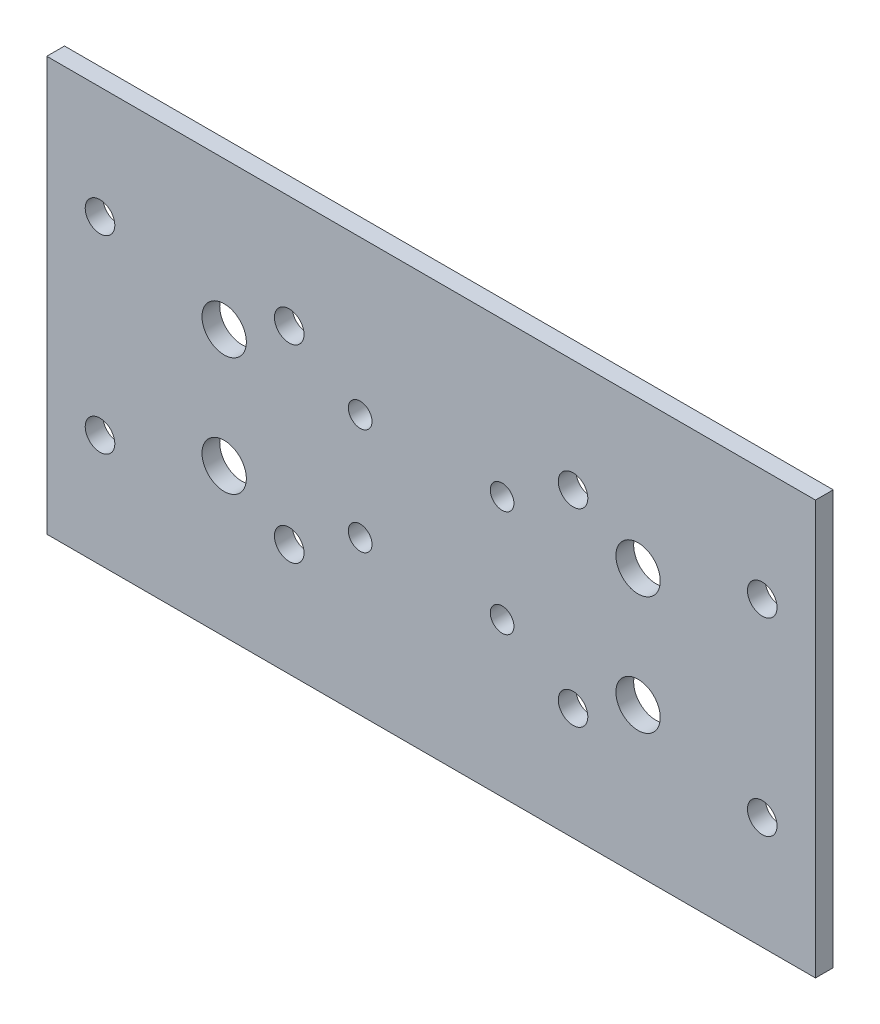
from build123d import *

# Parameters (mm, degrees)
SKETCH1_W          = 130
SKETCH1_H          = 70
BASE_FLANGE1_DEPTH = 3
SKETCH12_R         = 2.5
SKETCH12_R_2       = 2
CUT_EXTRUDE1_DEPTH = 10
SKETCH13_R         = 3.75
CUT_EXTRUDE2_DEPTH = 10


# Sheet-metal steps are written as plain solids
with BuildPart() as part:
    # Sketch1 → Base-Flange1 (new body)
    with BuildSketch(Plane.XY):
        Rectangle(SKETCH1_W, SKETCH1_H)
    extrude(amount=BASE_FLANGE1_DEPTH)

    # Sketch12 → Cut-Extrude1 (cut)
    with BuildSketch(Plane(origin=(0, 0, 0), x_dir=(-1, 0, 0), z_dir=(0, 0, -1))):
        with Locations((56, 16)):
            Circle(SKETCH12_R)
        with Locations((56, -16)):
            Circle(SKETCH12_R)
        with Locations((24, -16)):
            Circle(SKETCH12_R)
        with Locations((24, 16)):
            Circle(SKETCH12_R)
        with Locations(Location((-24, 16, 0), (0, 0, 180))):
            Circle(SKETCH12_R)
        with Locations(Location((-24, -16, 0), (0, 0, 180))):
            Circle(SKETCH12_R)
        with Locations(Location((-56, -16, 0), (0, 0, 180))):
            Circle(SKETCH12_R)
        with Locations(Location((-56, 16, 0), (0, 0, 180))):
            Circle(SKETCH12_R)
        with Locations((12, 9)):
            Circle(SKETCH12_R_2)
        with Locations(Location((-12, 9, 0), (0, 0, 180))):
            Circle(SKETCH12_R_2)
        with Locations((-12, -9)):
            Circle(SKETCH12_R_2)
        with Locations(Location((12, -9, 0), (0, 0, 180))):
            Circle(SKETCH12_R_2)
    extrude(amount=-CUT_EXTRUDE1_DEPTH, mode=Mode.SUBTRACT)

    # Sketch13 → Cut-Extrude2 (cut)
    with BuildSketch(Plane(origin=(0, 0, 0), x_dir=(-1, 0, 0), z_dir=(0, 0, -1))):
        with Locations((35, 10)):
            Circle(SKETCH13_R)
        with Locations((-35, 10)):
            Circle(SKETCH13_R)
        with Locations((-35, -10)):
            Circle(SKETCH13_R)
        with Locations((35, -10)):
            Circle(SKETCH13_R)
    extrude(amount=-CUT_EXTRUDE2_DEPTH, mode=Mode.SUBTRACT)


solid = part.part
